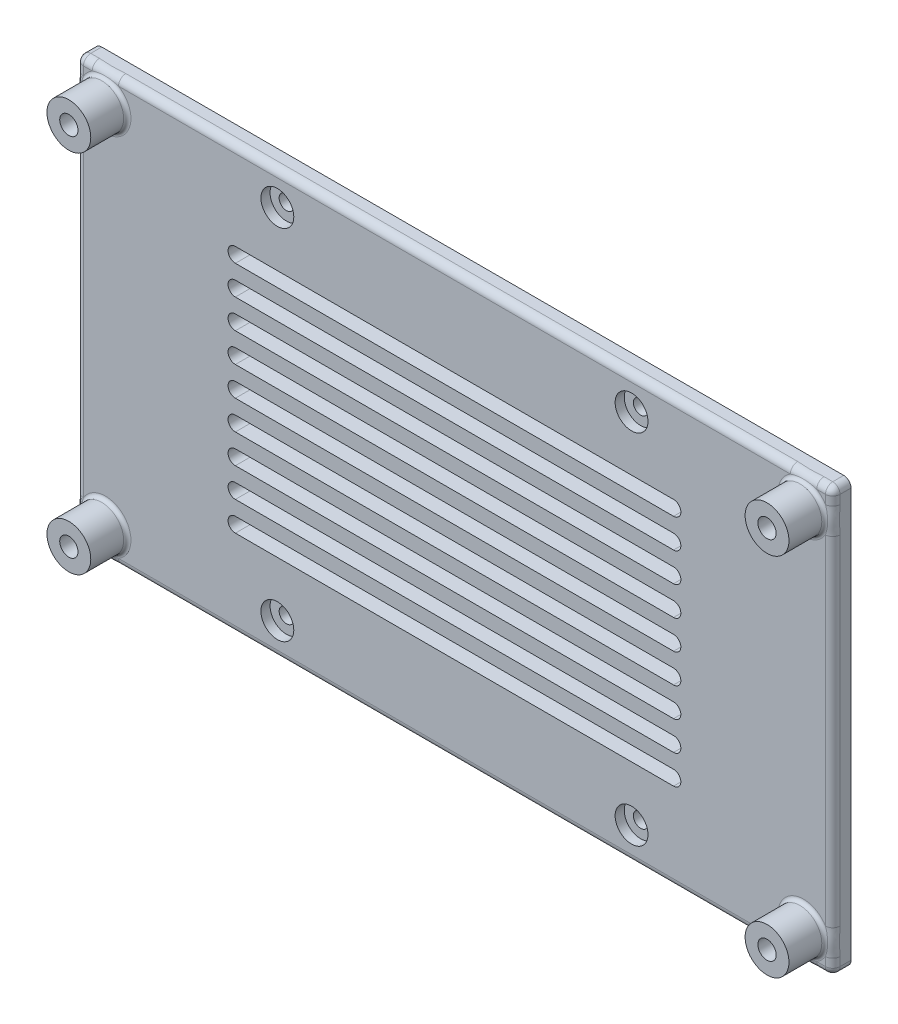
from build123d import *

# Parameters (mm, degrees)
ESQUISSE1_W                                   = 103.6
ESQUISSE1_H                                   = 58
ESQUISSE1_R                                   = 1.005
BOSS_EXTRU_1_DEPTH                            = 2.5
ESQUISSE3_R                                   = 3
BOSS_EXTRU_2_DEPTH                            = 5
CONG_2_R                                      = 0.5
TROU_POUR_TARAUDAGE_POUR_TROU_TARAUD_M3_D     = 2.5
TROU_POUR_TARAUDAGE_POUR_TROU_TARAUD_M3_DEPTH = 5
TROU_POUR_TARAUDAGE_POUR_TROU_TARAUD_M3_TIP   = 0.751075774
ESQUISSE19_R                                  = 2.25
ENL_V_MAT_EXTRU_1_DEPTH                       = 1.25
CONG_3_R                                      = 1
ENL_V_MAT_EXTRU_3_DEPTH                       = 60.575498455
R_P_TITION_LIN_AIRE2_COUNT                    = 5
R_P_TITION_LIN_AIRE2_PITCH                    = 4
R_P_TITION_LIN_AIRE2_COL_COUNT                = 5
R_P_TITION_LIN_AIRE2_COL_PITCH                = 4


with BuildPart() as part:
    # Esquisse1 → Boss.-Extru.1 (new body)
    with BuildSketch(Plane.XY):
        Rectangle(ESQUISSE1_W, ESQUISSE1_H)
        with Locations((-24.25, -24.5)):
            Circle(ESQUISSE1_R, mode=Mode.SUBTRACT)
        with Locations((-24.25, 24.5)):
            Circle(ESQUISSE1_R, mode=Mode.SUBTRACT)
        with Locations((24.25, -24.5)):
            Circle(ESQUISSE1_R, mode=Mode.SUBTRACT)
        with Locations((24.25, 24.5)):
            Circle(ESQUISSE1_R, mode=Mode.SUBTRACT)
    extrude(amount=BOSS_EXTRU_1_DEPTH)

    # Esquisse3 → Boss.-Extru.2 (add)
    with BuildSketch(Plane.XY.offset(2.5)):
        with Locations((-47.8, 25)):
            Circle(ESQUISSE3_R)
        with Locations((47.8, 25)):
            Circle(ESQUISSE3_R)
        with Locations((-47.8, -25)):
            Circle(ESQUISSE3_R)
        with Locations((47.8, -25)):
            Circle(ESQUISSE3_R)
    extrude(amount=BOSS_EXTRU_2_DEPTH)

    # Congé2
    cong_2_edges = [part.edges().sort_by_distance(p)[0] for p in [
        (44.8, 25, 2.5),
        (44.8, -25, 2.5),
        (-50.8, -25, 2.5),
        (-50.8, 25, 2.5),
    ]]
    fillet(cong_2_edges, radius=CONG_2_R)

    # Trou pour taraudage pour trou taraudé M32
    with Locations(Plane.XY.offset(7.5)):
        with Locations((-47.8, -25), (47.8, -25), (47.8, 25), (-47.8, 25)):
            Hole(TROU_POUR_TARAUDAGE_POUR_TROU_TARAUD_M3_D / 2, depth=TROU_POUR_TARAUDAGE_POUR_TROU_TARAUD_M3_DEPTH)
            with Locations((0, 0, -(TROU_POUR_TARAUDAGE_POUR_TROU_TARAUD_M3_DEPTH + TROU_POUR_TARAUDAGE_POUR_TROU_TARAUD_M3_TIP / 2))):  # 118° drill point
                Cone(0, TROU_POUR_TARAUDAGE_POUR_TROU_TARAUD_M3_D / 2, TROU_POUR_TARAUDAGE_POUR_TROU_TARAUD_M3_TIP, mode=Mode.SUBTRACT)

    # Esquisse19 → Enlèv. mat.-Extru.1 (cut)
    with BuildSketch(Plane.XY.offset(2.5)):
        with Locations((24.25, -24.5)):
            Circle(ESQUISSE19_R)
        with Locations((-24.25, -24.5)):
            Circle(ESQUISSE19_R)
        with Locations((-24.25, 24.5)):
            Circle(ESQUISSE19_R)
        with Locations((24.25, 24.5)):
            Circle(ESQUISSE19_R)
    extrude(amount=-ENL_V_MAT_EXTRU_1_DEPTH, mode=Mode.SUBTRACT)

    # Congé3
    cong_3_edges = [part.edges().sort_by_distance(p)[0] for p in [
        (-51.8, 0, 2.5),
        (0, -29, 2.5),
        (0, 29, 2.5),
        (51.8, 0, 2.5),
        (51.8, -29, 1.25),
        (51.8, 29, 1.25),
        (-51.8, 29, 1.25),
        (-51.8, -29, 1.25),
    ]]
    fillet(cong_3_edges, radius=CONG_3_R)

    # Esquisse22 → Enlèv. mat.-Extru.3 (cut, through all)
    with BuildSketch(Plane.XY.offset(2.5)):
        with BuildLine():
            Line((30, -1), (-30, -1))
            ThreePointArc((-30, -1), (-31, 0), (-30, 1))
            Line((-30, 1), (30, 1))
            ThreePointArc((30, 1), (31, 0), (30, -1))
        make_face()
    enl_v_mat_extru_3 = extrude(amount=-ENL_V_MAT_EXTRU_3_DEPTH, mode=Mode.SUBTRACT)

    # Répétition linéaire2: Enlèv. mat.-Extru.3 ×5
    with Locations(*[(0, i * R_P_TITION_LIN_AIRE2_PITCH, 0) for i in range(1, R_P_TITION_LIN_AIRE2_COUNT)]):
        add(enl_v_mat_extru_3, mode=Mode.SUBTRACT)

    # Répétition linéaire2 col: Enlèv. mat.-Extru.3 ×5
    with Locations(*[(0, -i * R_P_TITION_LIN_AIRE2_COL_PITCH, 0) for i in range(1, R_P_TITION_LIN_AIRE2_COL_COUNT)]):
        add(enl_v_mat_extru_3, mode=Mode.SUBTRACT)


solid = part.part
